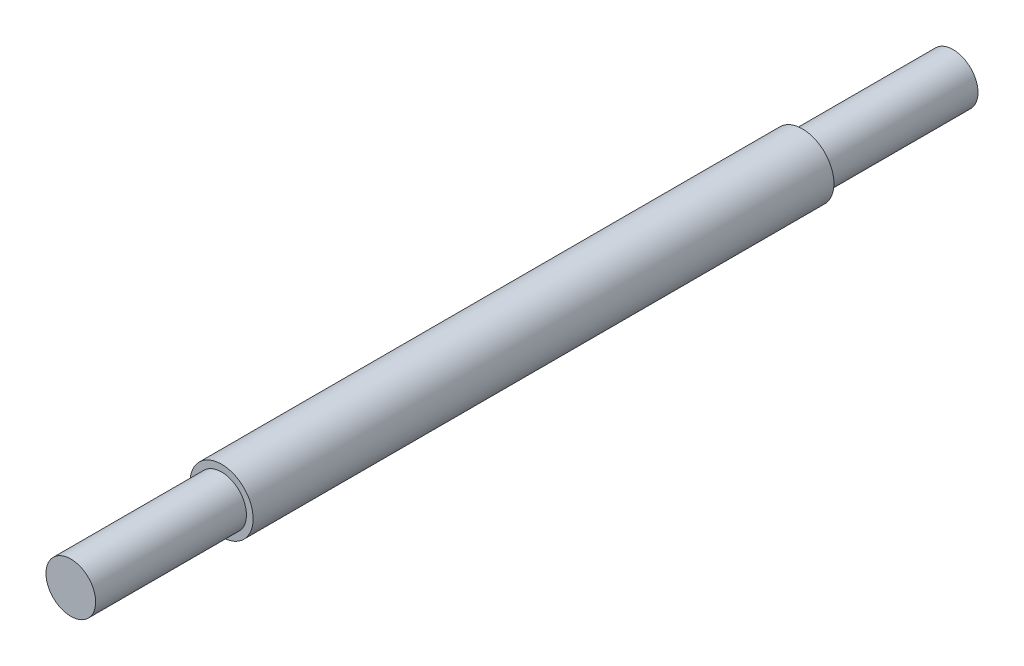
from build123d import *

# Parameters (mm, degrees)
BOSS_EXTRUDE1_DEPTH      = 44.3738
BOSS_EXTRUDE1_DEPTH_BACK = 44.3738
SKETCH2_R                = 2.5
BOSS_EXTRUDE2_DEPTH      = 29.21
BOSS_EXTRUDE2_DEPTH_BACK = 29.21
SKETCH3_R                = 3.175


with BuildPart() as part:
    # Sketch2 → Boss-Extrude1 (new, two sides: drawn at the far end of the back side and taken through both)
    with BuildSketch(Plane.XY.offset(-BOSS_EXTRUDE1_DEPTH_BACK)):
        Circle(SKETCH2_R)
    extrude(amount=BOSS_EXTRUDE1_DEPTH + BOSS_EXTRUDE1_DEPTH_BACK)

    # Sketch3 → Boss-Extrude2 (add, two sides: drawn at the far end of the back side and taken through both)
    with BuildSketch(Plane.XY.offset(-BOSS_EXTRUDE2_DEPTH_BACK)):
        Circle(SKETCH3_R)
    extrude(amount=BOSS_EXTRUDE2_DEPTH + BOSS_EXTRUDE2_DEPTH_BACK)


solid = part.part
